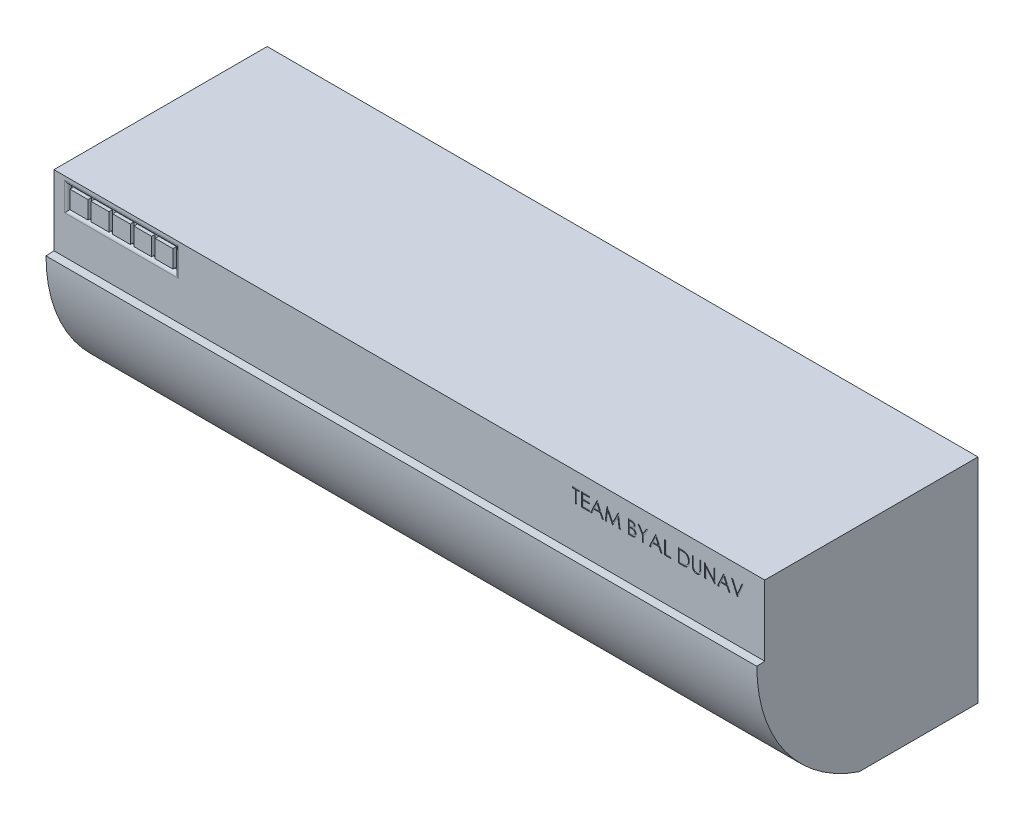
from build123d import *

# Parameters (mm, degrees)
BOSS_EXTRUDE1_DEPTH = 1000
BOSS_EXTRUDE3_START = -1000
BOSS_EXTRUDE3_DEPTH = 1000
SKETCH6_W           = 284.363748689
SKETCH6_H           = 16.669705656
CUT_EXTRUDE2_DEPTH  = 1000
SKETCH7_W           = 25
SKETCH7_H           = 25.000000002
CUT_EXTRUDE5_DEPTH  = 5
FILLET2_R           = 5
CUT_EXTRUDE6_DEPTH  = 1


with BuildPart() as part:
    # Sketch1 → Boss-Extrude1 (new body)
    with BuildSketch(Plane(origin=(0, 0, 0), x_dir=(0, 0, -1), z_dir=(1, 0, 0))):
        with BuildLine():
            Line((150.000815691, -150.000815691), (50.479353553, -150.000815691))
            ThreePointArc((50.479353553, -150.000815691), (-91.513867458, -91.048589684), (-149.999184309, 51.137582207))
            Line((-149.999184309, 51.137582207), (-149.999184309, 149.999184309))
            Line((-149.999184309, 149.999184309), (150.000815691, 149.999184309))
            Line((150.000815691, 149.999184309), (150.000815691, -150.000815691))
        make_face()
    extrude(amount=BOSS_EXTRUDE1_DEPTH)

    # Sketch5 → Boss-Extrude3 (add)
    with BuildSketch(Plane(origin=(1000, 0, 0), x_dir=(0, 0, -1), z_dir=(1, 0, 0)).offset(BOSS_EXTRUDE3_START)):
        with BuildLine():
            Line((-161.130497718, 50.478804549), (-149.999184309, 51.137582207))
            ThreePointArc((-149.999184309, 51.137582207), (-91.513867458, -91.048589684), (50.479353553, -150.000815691))
            Line((50.479353553, -150.000815691), (50.479353553, -161.131046722))
            ThreePointArc((50.479353553, -161.131046722), (-99.151407247, -99.151956251), (-161.130497718, 50.478804549))
        make_face()
    extrude(amount=BOSS_EXTRUDE3_DEPTH)

    # Sketch6 → Cut-Extrude2 (cut)
    with BuildSketch(Plane(origin=(1000, 0, 0), x_dir=(0, 0, -1), z_dir=(1, 0, 0))):
        with Locations((7.818941346, -158.335668519)):
            Rectangle(SKETCH6_W, SKETCH6_H)
    extrude(amount=-CUT_EXTRUDE2_DEPTH, mode=Mode.SUBTRACT)

    # Sketch7 → Cut-Extrude5 (cut)
    with BuildSketch(Plane.XY.offset(149.999184309)):
        Polygon((22.5, 139.999184309), (20, 139.999184309), (20, 109.999184309), (22.5, 109.999184309), (77.5, 109.999184309), (82.5, 109.999184309), (107.5, 109.999184309), (112.5, 109.999184311), (137.5, 109.999184309), (142.5, 109.999184309), (167.5, 109.999184309), (170, 109.999184309), (170, 139.999184309), (167.5, 139.999184309), (142.5, 139.999184309), (137.5, 139.999184309), (112.5, 139.999184309), (107.5, 139.999184309), (82.5, 139.999184309), (77.5, 139.999184309), (52.5, 139.999184309), (47.025722903, 139.999184309), align=None)
        Polygon((47.974277105, 137.499184311), (47.974277105, 137.070562704), (47.974277105, 112.499184309), (22.5, 112.499184309), (22.5, 137.499184311), (47.916666667, 137.499184311), align=None, mode=Mode.SUBTRACT)
        Polygon((77.5, 112.499184309), (52.025722903, 112.499184309), (52.025722903, 137.499184311), (52.083333333, 137.499184311), (77.5, 137.499184311), align=None, mode=Mode.SUBTRACT)
        with Locations((95, 124.99918431)):
            Rectangle(SKETCH7_W, SKETCH7_H, mode=Mode.SUBTRACT)
        with Locations((125, 124.99918431)):
            Rectangle(SKETCH7_W, SKETCH7_H, mode=Mode.SUBTRACT)
        with Locations((155, 124.99918431)):
            Rectangle(SKETCH7_W, SKETCH7_H, mode=Mode.SUBTRACT)
    extrude(amount=-CUT_EXTRUDE5_DEPTH, mode=Mode.SUBTRACT)

    # Fillet2
    fillet2_edges = [part.edges().sort_by_distance(p)[0] for p in [
        (63.75, 109.99918431, 149.999184309),
        (170, 124.999184309, 149.999184309),
        (20, 124.999184309, 149.999184309),
        (95, 139.999184309, 149.999184309),
    ]]
    fillet(fillet2_edges, radius=FILLET2_R - 0.0001)  # a hair under: the kernel refuses the full size

    # Sketch8 → Cut-Extrude6 (cut)
    # profile 1 of 13: a face of its own
    with BuildSketch(Plane.XY.offset(149.999184309)):
        Polygon((953.431730769, 129.049184309), (955.263461538, 129.049184309), (961.613461538, 114.036624213), (967.963461538, 129.049184309), (969.795192308, 129.049184309), (961.735576923, 109.999184309), (961.491346154, 109.999184309), align=None)
    # profile 2 of 13: a face of its own
    with BuildSketch(Plane.XY.offset(149.999184309)):
        Polygon((942.685576923, 129.049184309), (951.477884615, 109.999184309), (949.619441106, 109.999184309), (946.803155048, 116.10495354), (938.167307692, 116.10495354), (935.270883413, 109.999184309), (933.404807692, 109.999184309), (942.441346154, 129.049184309), align=None)
        Polygon((942.54438101, 125.336113396), (939.094621394, 118.058799694), (945.902554087, 118.058799694), align=None, mode=Mode.SUBTRACT)
    # profile 3 of 13: a face of its own
    with BuildSketch(Plane.XY.offset(149.999184309)):
        Polygon((915.331730769, 109.999184309), (915.331730769, 129.049184309), (915.690444712, 129.049184309), (928.275961538, 114.055704742), (928.275961538, 129.049184309), (929.985576923, 129.049184309), (929.985576923, 109.999184309), (929.596334135, 109.999184309), (917.041346154, 124.958318925), (917.041346154, 109.999184309), align=None)
    # profile 4 of 13: a face of its own
    with BuildSketch(Plane.XY.offset(149.999184309)):
        with BuildLine():
            Line((898.235576923, 129.049184309), (899.945192308, 129.049184309))
            Line((899.945192308, 129.049184309), (899.945192308, 117.635211953))
            add(Edge.make_bspline(
                [(899.945192308, 117.635211953), (899.944937887, 117.473663949), (899.94445508, 117.167098771), (899.947680048, 116.730754164), (899.956711753, 116.342828351), (899.96240585, 116.001826016), (899.975073194, 115.709311919), (899.985403992, 115.4637013), (899.998687594, 115.266157141), (900.014652133, 115.150872386), (900.021514423, 115.101317723)],
                knots=[0, 0, 0, 0, 1.528628734, 2.90083645, 4.128790002, 5.200304208, 6.127813768, 6.898992206, 7.526736466, 8, 8, 8, 8], degree=3))
            add(Edge.make_bspline(
                [(900.021514423, 115.101317723), (900.049694592, 114.922537482), (900.104467077, 114.575050628), (900.244056648, 114.080249837), (900.439006189, 113.634308614), (900.670017607, 113.223311444), (900.97445082, 112.858697927), (901.339141491, 112.522810217), (901.780980488, 112.229049394), (902.272256071, 111.960439976), (902.801765721, 111.744548599), (903.342847042, 111.581299001), (903.887366685, 111.481809561), (904.251908384, 111.470289542), (904.432932692, 111.464568925)],
                knots=[0, 0, 0, 0, 1.035780045, 2.013197591, 2.933192213, 3.817615948, 4.702609284, 5.640816605, 6.646850145, 7.73207398, 8.84249596, 9.914020372, 10.964143139, 12, 12, 12, 12], degree=3))
            add(Edge.make_bspline(
                [(904.432932692, 111.464568925), (904.588346622, 111.470413738), (904.898276852, 111.482069608), (905.358777568, 111.554249682), (905.807269587, 111.684337047), (906.245967574, 111.852193446), (906.657180789, 112.073976763), (907.041138666, 112.330176618), (907.383842365, 112.630681529), (907.696578039, 112.963241976), (907.968911047, 113.338471458), (908.204973975, 113.74819961), (908.398336535, 114.198592484), (908.493823435, 114.515118696), (908.542878606, 114.677729982)],
                knots=[0, 0, 0, 0, 0.994687771, 1.983630487, 2.973142513, 3.978332533, 4.983357753, 5.956394766, 6.925816176, 7.893390482, 8.871859704, 9.88551698, 10.913711441, 12, 12, 12, 12], degree=3))
            add(Edge.make_bspline(
                [(908.542878606, 114.677729982), (908.559207859, 114.744941508), (908.595596016, 114.894715875), (908.62959779, 115.147924613), (908.665011878, 115.44667958), (908.689584038, 115.793127304), (908.713539252, 116.186106883), (908.727870691, 116.627665513), (908.734494827, 117.116199829), (908.736468844, 117.457124952), (908.7375, 117.635211953)],
                knots=[0, 0, 0, 0, 0.558680831, 1.244966039, 2.062412453, 2.990489873, 4.051219941, 5.244515665, 6.560634259, 8, 8, 8, 8], degree=3))
            Line((908.7375, 117.635211953), (908.7375, 129.049184309))
            Line((908.7375, 129.049184309), (910.447115385, 129.049184309))
            Line((910.447115385, 129.049184309), (910.447115385, 117.543625415))
            add(Edge.make_bspline(
                [(910.447115385, 117.543625415), (910.445732244, 117.336261381), (910.44303296, 116.931577861), (910.419625537, 116.338571178), (910.382303866, 115.776035666), (910.329572987, 115.243895706), (910.259703013, 114.744055496), (910.182005027, 114.27213383), (910.083056425, 113.831518255), (909.967486056, 113.418773239), (909.835368602, 113.025877802), (909.664238923, 112.652995199), (909.47142843, 112.288789681), (909.242748677, 111.938769832), (908.985783866, 111.601385878), (908.694854003, 111.278683913), (908.37958107, 110.965507104), (908.034724039, 110.669888844), (907.665967608, 110.398787331), (907.274408696, 110.16040232), (906.863055135, 109.958888059), (906.432976206, 109.793011956), (905.983988373, 109.668291066), (905.516080315, 109.575353432), (905.028186991, 109.522545213), (904.696365077, 109.514696994), (904.528335337, 109.510722771)],
                knots=[0, 0, 0, 0, 1.316592851, 2.569410997, 3.76748051, 4.895814652, 5.963796859, 6.97159953, 7.931736103, 8.829262218, 9.692595152, 10.560224239, 11.431080259, 12.30701507, 13.211635791, 14.121146779, 15.063487852, 16.031507147, 17.00238618, 17.966455255, 18.938106653, 19.907068911, 20.888905087, 21.893141452, 22.933117798, 24, 24, 24, 24], degree=3))
            add(Edge.make_bspline(
                [(904.528335337, 109.510722771), (904.345079221, 109.514994136), (903.985531378, 109.523374539), (903.455734183, 109.571395508), (902.947838343, 109.661847054), (902.456479641, 109.777017605), (901.988347678, 109.935860518), (901.537170502, 110.12145174), (901.110675395, 110.349383685), (900.701943338, 110.602984867), (900.321897165, 110.888324684), (899.973024156, 111.199330488), (899.654748347, 111.531020256), (899.372434442, 111.886985104), (899.121405056, 112.264456538), (898.90515918, 112.6645024), (898.719485666, 113.086967807), (898.623655637, 113.380627369), (898.575210337, 113.529082146)],
                knots=[0, 0, 0, 0, 1.13879206, 2.234305948, 3.301075583, 4.341971843, 5.366689343, 6.369221514, 7.369726634, 8.367512178, 9.355451585, 10.318319045, 11.268648973, 12.207971039, 13.137398894, 14.081662264, 15.030215811, 16, 16, 16, 16], degree=3))
            add(Edge.make_bspline(
                [(898.575210337, 113.529082146), (898.547031804, 113.630496587), (898.48591194, 113.850466768), (898.420459963, 114.21452037), (898.365437676, 114.633701564), (898.31370028, 115.108039044), (898.283171523, 115.637900461), (898.256406607, 116.223056132), (898.235388367, 116.864213609), (898.235512314, 117.310824615), (898.235576923, 117.543625415)],
                knots=[0, 0, 0, 0, 0.625038921, 1.35572334, 2.194682327, 3.136881307, 4.189498639, 5.346923369, 6.617055217, 8, 8, 8, 8], degree=3))
            Line((898.235576923, 117.543625415), (898.235576923, 129.049184309))
        make_face()
    # profile 5 of 13: a face of its own
    with BuildSketch(Plane.XY.offset(149.999184309)):
        with BuildLine():
            Line((878.697115385, 109.999184309), (878.697115385, 129.049184309))
            Line((878.697115385, 129.049184309), (882.54375, 129.049184309))
            add(Edge.make_bspline(
                [(882.54375, 129.049184309), (882.878316922, 129.046775464), (883.524698473, 129.042121587), (884.458760508, 129.01261373), (885.322997844, 128.960414194), (886.11456812, 128.884380059), (886.835644431, 128.791018548), (887.484207712, 128.673994918), (888.063611518, 128.535810734), (888.419952331, 128.41799764), (888.588461538, 128.362285271)],
                knots=[0, 0, 0, 0, 1.314313732, 2.53924729, 3.670748893, 4.714932338, 5.66265055, 6.526160246, 7.303039223, 8, 8, 8, 8], degree=3))
            add(Edge.make_bspline(
                [(888.588461538, 128.362285271), (888.80886862, 128.278298144), (889.24468468, 128.112228441), (889.865209162, 127.798957715), (890.44936578, 127.444012118), (891.000287126, 127.04692378), (891.505388767, 126.596449255), (891.984403176, 126.11172426), (892.417734744, 125.575122008), (892.814564184, 124.997771002), (893.172353988, 124.386472547), (893.483354261, 123.742391455), (893.741639568, 123.068798651), (893.956051273, 122.367567346), (894.125032706, 121.637155632), (894.240322934, 120.876713018), (894.316365036, 120.089244859), (894.324007087, 119.554895278), (894.327884615, 119.283769646)],
                knots=[0, 0, 0, 0, 0.984719456, 1.947108742, 2.898477687, 3.838006223, 4.779231079, 5.722358779, 6.681677486, 7.655904652, 8.64651281, 9.637519902, 10.640069247, 11.656948941, 12.698408672, 13.768548281, 14.867775369, 16, 16, 16, 16], degree=3))
            add(Edge.make_bspline(
                [(894.327884615, 119.283769646), (894.324461235, 119.048304905), (894.317715107, 118.584297039), (894.257139831, 117.900451593), (894.169094432, 117.236893441), (894.032782441, 116.596782416), (893.867305903, 115.974510259), (893.655229594, 115.376709043), (893.412284965, 114.797894881), (893.128984911, 114.245894048), (892.817972516, 113.722925978), (892.484207028, 113.229936318), (892.128044443, 112.773959754), (891.746088498, 112.353615451), (891.34327507, 111.969537089), (890.916966928, 111.618516262), (890.466064037, 111.307421299), (889.992585961, 111.024027468), (889.482720172, 110.776810961), (888.926809243, 110.567641908), (888.322482403, 110.39430533), (887.671223009, 110.24968374), (886.971905794, 110.134962993), (886.223845137, 110.058075057), (885.428190375, 110.006079809), (884.881840374, 110.001527439), (884.60063101, 109.999184309)],
                knots=[0, 0, 0, 0, 1.105936401, 2.179363191, 3.223086493, 4.248585256, 5.251745608, 6.245858792, 7.225916811, 8.198733463, 9.158002045, 10.082870192, 10.993790845, 11.873723703, 12.748670949, 13.606408763, 14.465103618, 15.319838547, 16.196477973, 17.123216899, 18.106603292, 19.147568657, 20.255746949, 21.433717677, 22.679120308, 24, 24, 24, 24], degree=3))
            Line((884.60063101, 109.999184309), (878.697115385, 109.999184309))
        make_face()
        with BuildLine():
            Line((880.406730769, 111.953030463), (882.593359375, 111.953030463))
            add(Edge.make_bspline(
                [(882.593359375, 111.953030463), (882.90756665, 111.954380816), (883.51190231, 111.95697804), (884.380897981, 111.979768388), (885.174898696, 112.017008077), (885.894017197, 112.069123857), (886.537847458, 112.13807732), (887.107735011, 112.214957148), (887.601811774, 112.310737558), (887.900784852, 112.397556352), (888.038942308, 112.437675896)],
                knots=[0, 0, 0, 0, 1.375205317, 2.645023457, 3.804390687, 4.853969522, 5.800190428, 6.637939096, 7.370582563, 8, 8, 8, 8], degree=3))
            add(Edge.make_bspline(
                [(888.038942308, 112.437675896), (888.212832678, 112.49891652), (888.556460052, 112.619935037), (889.051112816, 112.840684593), (889.512433084, 113.102170716), (889.948460507, 113.392831664), (890.353009875, 113.722919189), (890.730875422, 114.085255571), (891.081296369, 114.481684847), (891.400652246, 114.911714983), (891.686447443, 115.372669443), (891.933940849, 115.860016523), (892.150847043, 116.368416447), (892.321091954, 116.905676296), (892.454526776, 117.466993029), (892.549040292, 118.052406132), (892.607903292, 118.661806281), (892.614769173, 119.076291414), (892.618269231, 119.287585752)],
                knots=[0, 0, 0, 0, 0.998632004, 1.973411704, 2.929992603, 3.868527914, 4.809262121, 5.754881198, 6.702106254, 7.672490631, 8.653608572, 9.636854334, 10.631411391, 11.644891563, 12.686317036, 13.754757253, 14.855430412, 16, 16, 16, 16], degree=3))
            add(Edge.make_bspline(
                [(892.618269231, 119.287585752), (892.615475481, 119.510380837), (892.609987135, 119.948063755), (892.541002674, 120.590270253), (892.440192493, 121.207929223), (892.294412716, 121.801081972), (892.108643219, 122.370885717), (891.876806668, 122.914189051), (891.611921212, 123.436729838), (891.296761622, 123.926447457), (890.951599606, 124.389597094), (890.568542863, 124.813894563), (890.153677196, 125.200306397), (889.711527516, 125.55485037), (889.229632733, 125.863262664), (888.719344787, 126.139143028), (888.173177634, 126.373272379), (887.793197104, 126.497798761), (887.600090144, 126.561083348)],
                knots=[0, 0, 0, 0, 1.122418816, 2.205001699, 3.251619955, 4.274784885, 5.280384055, 6.268708349, 7.249350384, 8.229342522, 9.199999885, 10.157847722, 11.105861043, 12.055065948, 13.010012805, 13.98527497, 14.976112212, 16, 16, 16, 16], degree=3))
            add(Edge.make_bspline(
                [(887.600090144, 126.561083348), (887.440336048, 126.605259905), (887.100655006, 126.699191387), (886.546357352, 126.8016552), (885.922523467, 126.892031116), (885.226383665, 126.968547016), (884.458731481, 127.023450865), (883.618976522, 127.064660449), (882.706755817, 127.09245512), (882.074390883, 127.094353084), (881.746183894, 127.095338155)],
                knots=[0, 0, 0, 0, 0.674548936, 1.434276114, 2.292660221, 3.240891867, 4.284742987, 5.42552168, 6.663806718, 8, 8, 8, 8], degree=3))
            Line((881.746183894, 127.095338155), (880.406730769, 127.095338155))
            Line((880.406730769, 127.095338155), (880.406730769, 111.953030463))
        make_face(mode=Mode.SUBTRACT)
    # profile 6 of 13: a face of its own
    with BuildSketch(Plane.XY.offset(149.999184309)):
        Polygon((859.158653846, 129.049184309), (860.868269231, 129.049184309), (860.868269231, 111.953030463), (868.195192308, 111.953030463), (868.195192308, 109.999184309), (859.158653846, 109.999184309), align=None)
    # profile 7 of 13: a face of its own
    with BuildSketch(Plane.XY.offset(149.999184309)):
        Polygon((846.947115385, 129.049184309), (855.739423077, 109.999184309), (853.880979567, 109.999184309), (851.06469351, 116.10495354), (842.428846154, 116.10495354), (839.532421875, 109.999184309), (837.666346154, 109.999184309), (846.702884615, 129.049184309), align=None)
        Polygon((846.805919471, 125.336113396), (843.356159856, 118.058799694), (850.164092548, 118.058799694), align=None, mode=Mode.SUBTRACT)
    # profile 8 of 13: a face of its own
    with BuildSketch(Plane.XY.offset(149.999184309)):
        Polygon((821.791346154, 129.049184309), (823.749008413, 129.049184309), (828.755739183, 120.863637434), (833.75483774, 129.049184309), (835.7125, 129.049184309), (829.606730769, 119.0548033), (829.606730769, 109.999184309), (827.897115385, 109.999184309), (827.897115385, 119.0548033), align=None)
    # profile 9 of 13: a face of its own
    with BuildSketch(Plane.XY.offset(149.999184309)):
        with BuildLine():
            Line((808.114423077, 129.049184309), (811.831310096, 129.049184309))
            add(Edge.make_bspline(
                [(811.831310096, 129.049184309), (812.013256527, 129.048227725), (812.365913994, 129.046373626), (812.878736956, 129.017618298), (813.359062625, 128.978409752), (813.8070303, 128.916197391), (814.22243298, 128.841130718), (814.606522549, 128.750225119), (814.958077629, 128.641223122), (815.377791237, 128.467888363), (815.856330834, 128.210315118), (816.374482086, 127.829703927), (816.817553732, 127.36416295), (817.19956783, 126.839021639), (817.503285352, 126.261339796), (817.723009671, 125.644886211), (817.862117535, 124.997612159), (817.876423727, 124.553240005), (817.883653846, 124.328661473)],
                knots=[0, 0, 0, 0, 1.001505555, 1.941167018, 2.826882275, 3.653841531, 4.429895133, 5.150066043, 5.825578002, 6.45369114, 7.647487171, 8.808567382, 9.977351308, 11.170798116, 12.373658725, 13.556498008, 14.765093433, 16, 16, 16, 16], degree=3))
            add(Edge.make_bspline(
                [(817.883653846, 124.328661473), (817.877703614, 124.118281134), (817.866010848, 123.704863928), (817.754199543, 123.100194562), (817.579153619, 122.524605785), (817.335829335, 121.980198231), (817.01958847, 121.479272422), (816.644802478, 121.017787445), (816.19262731, 120.615282406), (815.853846247, 120.390258894), (815.681760817, 120.275957146)],
                knots=[0, 0, 0, 0, 1.044552857, 2.05264487, 3.044412934, 4.028983338, 5.005914585, 5.980388656, 6.974128949, 8, 8, 8, 8], degree=3))
            add(Edge.make_bspline(
                [(815.681760817, 120.275957146), (815.898171145, 120.192871937), (816.31221771, 120.033909352), (816.88200872, 119.752864898), (817.372926377, 119.447182554), (817.788745128, 119.113362055), (818.14436865, 118.753541242), (818.454899661, 118.36244412), (818.719865426, 117.934968881), (818.94690291, 117.475572496), (819.124061139, 116.988945861), (819.256735704, 116.479653494), (819.332758534, 115.949521629), (819.343576982, 115.588739779), (819.349038462, 115.406606184)],
                knots=[0, 0, 0, 0, 1.27268992, 2.434971085, 3.483601985, 4.442670788, 5.356604649, 6.2567628, 7.179492994, 8.113709626, 9.066344395, 10.018646069, 10.999752585, 12, 12, 12, 12], degree=3))
            add(Edge.make_bspline(
                [(819.349038462, 115.406606184), (819.343721628, 115.22064078), (819.33326061, 114.854748638), (819.256081049, 114.317238549), (819.125402909, 113.803569196), (818.945401384, 113.31041813), (818.710475072, 112.838739398), (818.424572866, 112.387998633), (818.083678213, 111.962724634), (817.702336026, 111.558191771), (817.270923491, 111.194457671), (816.805473454, 110.870522182), (816.300124198, 110.604115758), (815.763175488, 110.380327127), (815.188603996, 110.209382232), (814.578989804, 110.089788651), (813.934858676, 110.00920695), (813.492845602, 110.002581878), (813.266165865, 109.999184309)],
                knots=[0, 0, 0, 0, 0.978564426, 1.925352924, 2.850884081, 3.763762016, 4.682927383, 5.618979971, 6.567305752, 7.547517671, 8.540179244, 9.531824382, 10.526200242, 11.540722885, 12.589160233, 13.674978461, 14.80764778, 16, 16, 16, 16], degree=3))
            Line((813.266165865, 109.999184309), (808.114423077, 109.999184309))
            Line((808.114423077, 109.999184309), (808.114423077, 129.049184309))
        make_face()
        with BuildLine():
            Line((809.824038462, 127.095338155), (809.824038462, 120.989568925))
            Line((809.824038462, 120.989568925), (810.972686298, 120.989568925))
            add(Edge.make_bspline(
                [(810.972686298, 120.989568925), (811.140591884, 120.991745648), (811.465019694, 120.995951522), (811.934846559, 121.00799938), (812.370955587, 121.041734444), (812.772593993, 121.075459814), (813.139129295, 121.130294355), (813.469749455, 121.195565767), (813.769643247, 121.264597007), (814.115479917, 121.381996643), (814.507762679, 121.555502275), (814.925954289, 121.824770412), (815.29462333, 122.145487249), (815.605939452, 122.515552341), (815.860727599, 122.923038295), (816.037695106, 123.361443458), (816.157695324, 123.819841606), (816.168534944, 124.134538096), (816.174038462, 124.294316521)],
                knots=[0, 0, 0, 0, 1.156816544, 2.235205308, 3.236616184, 4.169592532, 5.011045266, 5.787822928, 6.49130361, 7.128639758, 8.301311294, 9.436451833, 10.541879658, 11.654887649, 12.756523258, 13.837046038, 14.901820046, 16, 16, 16, 16], degree=3))
            add(Edge.make_bspline(
                [(816.174038462, 124.294316521), (816.171174538, 124.40004822), (816.165556639, 124.607452494), (816.119546521, 124.909799693), (816.041345866, 125.194154974), (815.940901784, 125.464415204), (815.800537635, 125.712129703), (815.635273642, 125.945863382), (815.435598671, 126.157656484), (815.208319583, 126.355610468), (814.947015507, 126.531112826), (814.651842333, 126.684823266), (814.318806548, 126.808598065), (813.953520866, 126.916998837), (813.550362518, 126.993135122), (813.113983878, 127.056562847), (812.640810621, 127.088853914), (812.31344942, 127.093128532), (812.144230769, 127.095338155)],
                knots=[0, 0, 0, 0, 0.91205012, 1.789085906, 2.630437955, 3.453916878, 4.269457761, 5.079663411, 5.91843418, 6.774407191, 7.675494373, 8.627863946, 9.638891023, 10.736472738, 11.911756761, 13.175263542, 14.539845004, 16, 16, 16, 16], degree=3))
            Line((812.144230769, 127.095338155), (809.824038462, 127.095338155))
        make_face(mode=Mode.SUBTRACT)
        with BuildLine():
            Line((809.824038462, 119.035722771), (809.824038462, 111.953030463))
            Line((809.824038462, 111.953030463), (812.258713942, 111.953030463))
            add(Edge.make_bspline(
                [(812.258713942, 111.953030463), (812.432988382, 111.955119145), (812.768879389, 111.959144805), (813.253844656, 111.972286881), (813.703332693, 112.002180553), (814.115292403, 112.049238677), (814.494172152, 112.100284236), (814.835426793, 112.168925637), (815.141822603, 112.247569265), (815.497101335, 112.369130974), (815.89717043, 112.557978908), (816.328303806, 112.842717769), (816.71162365, 113.18193463), (817.037135132, 113.574532891), (817.303905827, 114.001423399), (817.497973375, 114.453971661), (817.617666467, 114.924700032), (817.632156274, 115.245647424), (817.639423077, 115.406606184)],
                knots=[0, 0, 0, 0, 1.160039823, 2.235823828, 3.228722157, 4.157150951, 4.99529583, 5.772374946, 6.472645482, 7.099169577, 8.269452708, 9.405989375, 10.527446681, 11.663510218, 12.788923519, 13.866172445, 14.929861265, 16, 16, 16, 16], degree=3))
            add(Edge.make_bspline(
                [(817.639423077, 115.406606184), (817.63792028, 115.507262795), (817.634938928, 115.706952416), (817.589977581, 116.000408517), (817.524587804, 116.284666485), (817.440052428, 116.560498187), (817.3169379, 116.822916706), (817.173210848, 117.077112066), (817.004692362, 117.32342029), (816.742106259, 117.634818412), (816.360170172, 117.993595297), (815.817480437, 118.344863702), (815.200411215, 118.628152481), (814.752858718, 118.748436773), (814.521664663, 118.81057253)],
                knots=[0, 0, 0, 0, 0.723448775, 1.435228256, 2.130040452, 2.821711965, 3.505591119, 4.210454504, 4.921174351, 5.648778258, 7.137944449, 8.670945889, 10.280296675, 12, 12, 12, 12], degree=3))
            add(Edge.make_bspline(
                [(814.521664663, 118.81057253), (814.428977727, 118.829378059), (814.228013332, 118.870152323), (813.900312073, 118.913192823), (813.526192558, 118.951538078), (813.104790897, 118.979901664), (812.635573934, 119.009219851), (812.117539562, 119.020621664), (811.552803321, 119.034224779), (811.160959122, 119.035210667), (810.957421875, 119.035722771)],
                knots=[0, 0, 0, 0, 0.634451884, 1.375622551, 2.216452059, 3.157844607, 4.20941857, 5.370758133, 6.634282058, 8, 8, 8, 8], degree=3))
            Line((810.957421875, 119.035722771), (809.824038462, 119.035722771))
        make_face(mode=Mode.SUBTRACT)
    # profile 10 of 13: a face of its own
    with BuildSketch(Plane.XY.offset(149.999184309)):
        Polygon((775.631730769, 109.999184309), (778.146544471, 129.049184309), (778.39077524, 129.049184309), (786.255769231, 113.418415078), (794.101682692, 129.049184309), (794.349729567, 129.049184309), (796.879807692, 109.999184309), (795.162560096, 109.999184309), (793.338461538, 123.706636232), (786.461838942, 109.999184309), (786.07641226, 109.999184309), (779.173076923, 123.737165078), (777.352794471, 109.999184309), align=None)
    # profile 11 of 13: a face of its own
    with BuildSketch(Plane.XY.offset(149.999184309)):
        Polygon((764.397115385, 129.049184309), (773.189423077, 109.999184309), (771.330979567, 109.999184309), (768.51469351, 116.10495354), (759.878846154, 116.10495354), (756.982421875, 109.999184309), (755.116346154, 109.999184309), (764.152884615, 129.049184309), align=None)
        Polygon((764.255919471, 125.336113396), (760.806159856, 118.058799694), (767.614092548, 118.058799694), align=None, mode=Mode.SUBTRACT)
    # profile 12 of 13: a face of its own
    with BuildSketch(Plane.XY.offset(149.999184309)):
        Polygon((742.416346154, 129.049184309), (753.1625, 129.049184309), (753.1625, 127.095338155), (744.125961538, 127.095338155), (744.125961538, 121.233799694), (753.1625, 121.233799694), (753.1625, 119.27995354), (744.125961538, 119.27995354), (744.125961538, 111.953030463), (753.1625, 111.953030463), (753.1625, 109.999184309), (742.416346154, 109.999184309), align=None)
    # profile 13 of 13: a face of its own
    with BuildSketch(Plane.XY.offset(149.999184309)):
        Polygon((729.472115385, 127.095338155), (729.472115385, 129.049184309), (739.485576923, 129.049184309), (739.485576923, 127.095338155), (735.333653846, 127.095338155), (735.333653846, 109.999184309), (733.624038462, 109.999184309), (733.624038462, 127.095338155), align=None)
    extrude(amount=-CUT_EXTRUDE6_DEPTH, mode=Mode.SUBTRACT)


solid = part.part
